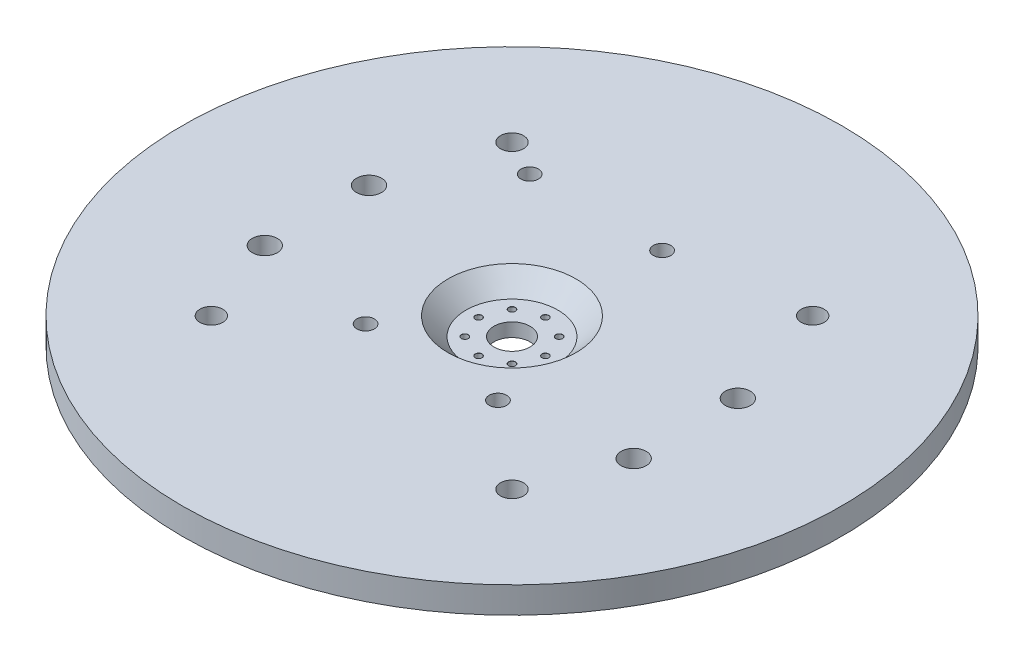
from build123d import *

# Parameters (mm, degrees)
SKETCH1_R                             = 79.0575
BOSS_EXTRUDE1_DEPTH                   = 3.1623
TAP_DRILL_FOR_M5X0_8_TAP1_D           = 4.2
TAP_DRILL_FOR_M7X1_0_TAP1_D           = 6
M5_CLEARANCE_HOLE1_D                  = 5.5
SKETCH32_R                            = 4.330200001
CUT_EXTRUDE1_DEPTH                    = 112.982932528
SKETCH32_4_R                          = 11
SKETCH32_4_R_2                        = 4.330200001
CUT_EXTRUDE2_DEPTH                    = 4.3246
CHAMFER1_SIZE                         = 4.35
TAP_DRILL_FOR_M2X0_4_TAP1_D           = 1.6
TAP_DRILL_FOR_M2X0_4_TAP1_CSINK_D     = 1.65
TAP_DRILL_FOR_M2X0_4_TAP1_CSINK_ANGLE = 90
BOSS_EXTRUDE3_START                   = 1.27
SKETCH35_R                            = 11
SKETCH35_R_2                          = 0.8
SKETCH35_R_3                          = 4.330200001
BOSS_EXTRUDE3_DEPTH                   = 1.27


with BuildPart() as part:
    # Sketch1 → Boss-Extrude1 (new, symmetric)
    with BuildSketch(Plane(origin=(0, 0, 0), x_dir=(1, 0, 0), z_dir=(0, 1, 0))):
        with Locations(Location((0, 0, 0), (0, 0, 270))):
            Circle(SKETCH1_R)
    extrude(amount=BOSS_EXTRUDE1_DEPTH, both=True)

    # Tap Drill for M5x0.8 Tap1 (through all)
    with Locations(Plane(origin=(0, 3.1623, 0), x_dir=(1, 0, 0), z_dir=(0, 1, 0))):
        with Locations((-27.3188086, 31.571183672), (4.4311914, 31.571183672), (-15.875, -19.245910728), (15.875, -19.245910728)):
            Hole(TAP_DRILL_FOR_M5X0_8_TAP1_D / 2)

    # Tap Drill for M7x1.0 Tap1 (through all)
    with Locations(Plane(origin=(0, 3.1623, 0), x_dir=(1, 0, 0), z_dir=(0, 1, 0))):
        with Locations((-44.245, 9.941583672), (-44.245, -15.058416328), (44.245, 9.941583672), (44.245, -15.058416328)):
            Hole(TAP_DRILL_FOR_M7X1_0_TAP1_D / 2)

    # M5 Clearance Hole1 (through all)
    with Locations(Plane(origin=(0, 3.1623, 0), x_dir=(1, 0, 0), z_dir=(0, 1, 0))):
        with Locations((-36.062445841, 36.062445841), (-36.062445841, -36.062445841), (36.062445841, -36.062445841), (36.062445841, 36.062445841)):
            Hole(M5_CLEARANCE_HOLE1_D / 2)

    # Sketch32 → Cut-Extrude1 (cut, through all)
    with BuildSketch(Plane(origin=(0, 3.1623, 0), x_dir=(1, 0, 0), z_dir=(0, 1, 0))):
        with Locations(Location((0, 0, 0), (0, 0, 270))):
            Circle(SKETCH32_R)
    extrude(amount=-CUT_EXTRUDE1_DEPTH, mode=Mode.SUBTRACT)

    # Sketch32<4> → Cut-Extrude2 (cut)
    with BuildSketch(Plane(origin=(0, 3.1623, 0), x_dir=(1, 0, 0), z_dir=(0, 1, 0))):
        with Locations(Location((0, 0, 0), (0, 0, 270))):
            Circle(SKETCH32_4_R)
        with Locations(Location((0, 0, 0), (0, 0, 270))):
            Circle(SKETCH32_4_R_2, mode=Mode.SUBTRACT)
    extrude(amount=-CUT_EXTRUDE2_DEPTH, mode=Mode.SUBTRACT)

    # Chamfer1
    # the kernel refuses this chamfer: 4.35 mm, written as the material it takes off along each edge
    with BuildSketch(Plane(origin=(0, 3.1623, 0), x_dir=(0, 0, 1), z_dir=(-1, 0, 0))) as chamfer1_piece_1_section:
        Polygon((11 + CHAMFER1_SIZE, 0), (11, -CHAMFER1_SIZE), (11, 0), align=None)
    chamfer1_piece_1 = revolve(axis=Axis((0, 3.1623, 0), (0, 1, 0)), mode=Mode.PRIVATE)
    chamfer1_piece_1 = split(chamfer1_piece_1, bisect_by=Plane(origin=(0, -1.1623, -13.183253191), z_dir=(0, 1, 0)), keep=Keep.TOP, mode=Mode.PRIVATE)
    add(chamfer1_piece_1, mode=Mode.SUBTRACT)

    # Tap Drill for M2x0.4 Tap1 (through all)
    with Locations(Plane(origin=(0, -1.1623, 0), x_dir=(1, 0, 0), z_dir=(0, 1, 0))):
        with Locations((-8, 0), (-5.656854249, 5.656854249), (0, 8), (5.656854249, 5.656854249), (8, 0), (5.656854249, -5.656854249), (0, -8), (-5.656854249, -5.656854249)):
            CounterSinkHole(TAP_DRILL_FOR_M2X0_4_TAP1_D / 2, TAP_DRILL_FOR_M2X0_4_TAP1_CSINK_D / 2, counter_sink_angle=TAP_DRILL_FOR_M2X0_4_TAP1_CSINK_ANGLE)

    # Sketch35 → Boss-Extrude3 (add)
    with BuildSketch(Plane.XZ.offset(3.1623).offset(BOSS_EXTRUDE3_START)):
        with Locations(Location((0, 0, 0), (0, 0, 90))):
            Circle(SKETCH35_R)
        with Locations(Location((-5.656854249, 5.656854249, 0), (0, 0, 90))):
            Circle(SKETCH35_R_2, mode=Mode.SUBTRACT)
        with Locations(Location((-8, 0, 0), (0, 0, 90))):
            Circle(SKETCH35_R_2, mode=Mode.SUBTRACT)
        with Locations(Location((-5.656854249, -5.656854249, 0), (0, 0, 90))):
            Circle(SKETCH35_R_2, mode=Mode.SUBTRACT)
        with Locations(Location((0, -8, 0), (0, 0, 90))):
            Circle(SKETCH35_R_2, mode=Mode.SUBTRACT)
        with Locations(Location((5.656854249, -5.656854249, 0), (0, 0, 90))):
            Circle(SKETCH35_R_2, mode=Mode.SUBTRACT)
        with Locations(Location((8, 0, 0), (0, 0, 90))):
            Circle(SKETCH35_R_2, mode=Mode.SUBTRACT)
        with Locations(Location((5.656854249, 5.656854249, 0), (0, 0, 90))):
            Circle(SKETCH35_R_2, mode=Mode.SUBTRACT)
        with Locations(Location((0, 8, 0), (0, 0, 90))):
            Circle(SKETCH35_R_2, mode=Mode.SUBTRACT)
        with Locations(Location((0, 0, 0), (0, 0, 90))):
            Circle(SKETCH35_R_3, mode=Mode.SUBTRACT)
    extrude(amount=-BOSS_EXTRUDE3_DEPTH)


solid = part.part
